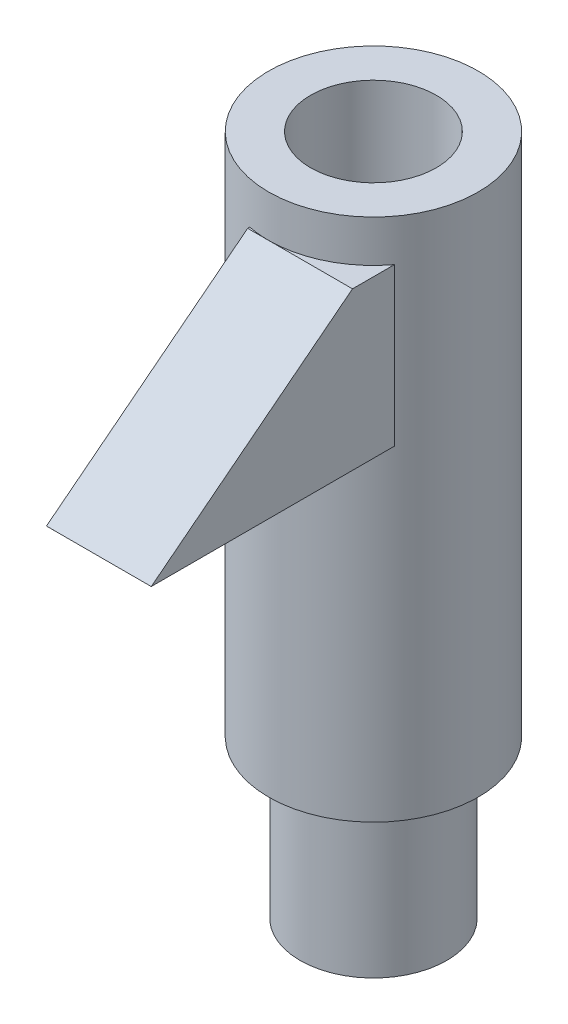
from build123d import *

# Parameters (mm, degrees)
CROQUIS1_R                   = 7
SALIENTE_EXTRUIR1_DEPTH      = 15
CROQUIS2_R                   = 10
SALIENTE_EXTRUIR2_DEPTH      = 50
SALIENTE_EXTRUIR3_DEPTH      = 30
SALIENTE_EXTRUIR3_DEPTH_BACK = 6
CROQUIS3_W                   = 10
CROQUIS3_H                   = 15
CHAFL_N1_SIZE                = 30
CHAFL_N1_SIZE_2              = 23.438568795
CROQUIS4_R                   = 6
CORTAR_EXTRUIR1_DEPTH        = 20


with BuildPart() as part:
    # Croquis1 → Saliente-Extruir1 (new body)
    with BuildSketch(Plane(origin=(0, 0, 0), x_dir=(1, 0, 0), z_dir=(0, 1, 0))):
        with Locations(Location((0, 0, 0), (0, 0, 270))):
            Circle(CROQUIS1_R)
    extrude(amount=SALIENTE_EXTRUIR1_DEPTH)

    # Croquis2 → Saliente-Extruir2 (add)
    with BuildSketch(Plane(origin=(0, 15, 0), x_dir=(1, 0, 0), z_dir=(0, 1, 0))):
        with Locations(Location((0, 0, 0), (0, 0, 270))):
            Circle(CROQUIS2_R)
    extrude(amount=SALIENTE_EXTRUIR2_DEPTH)

    # Croquis3 → Saliente-Extruir3 (add, two sides: drawn at the far end of the back side and taken through both)
    with BuildSketch(Plane.XY.offset(10).offset(-SALIENTE_EXTRUIR3_DEPTH_BACK)):
        with Locations((3, 53.5)):
            Rectangle(CROQUIS3_W, CROQUIS3_H)
    extrude(amount=SALIENTE_EXTRUIR3_DEPTH + SALIENTE_EXTRUIR3_DEPTH_BACK)

    # Chaflán1
    # the kernel refuses this chamfer: 30, 23.438568795 mm, written as the material it takes off along each edge
    with BuildSketch(Plane(origin=(85.38607652, 61, 40), x_dir=(0, 0.023867141339117135, -0.9997151392093142), z_dir=(-1, 0, 0))) as chafl_n1_piece_1_section:
        Polygon((CHAFL_N1_SIZE * 0.999715139209, CHAFL_N1_SIZE * 0.0238671413391), (-CHAFL_N1_SIZE_2 * 0.0238671413393, CHAFL_N1_SIZE_2 * 0.999715139218), (0, 0), align=None)
    chafl_n1_piece_1 = extrude(amount=164.77215304, mode=Mode.PRIVATE)
    chafl_n1_piece_1 = chafl_n1_piece_1 - Plane(origin=(0, 53.349255428, 0), x_dir=(0, 0, 1), z_dir=(0, -1, 0)) * Cylinder(10, 450, mode=Mode.PRIVATE)
    add(chafl_n1_piece_1, mode=Mode.SUBTRACT)

    # Croquis4 → Cortar-Extruir1 (cut)
    with BuildSketch(Plane(origin=(0, 65, 0), x_dir=(1, 0, 0), z_dir=(0, 1, 0))):
        with Locations(Location((0, 0, 0), (0, 0, 270))):
            Circle(CROQUIS4_R)
    extrude(amount=-CORTAR_EXTRUIR1_DEPTH, mode=Mode.SUBTRACT)


solid = part.part
